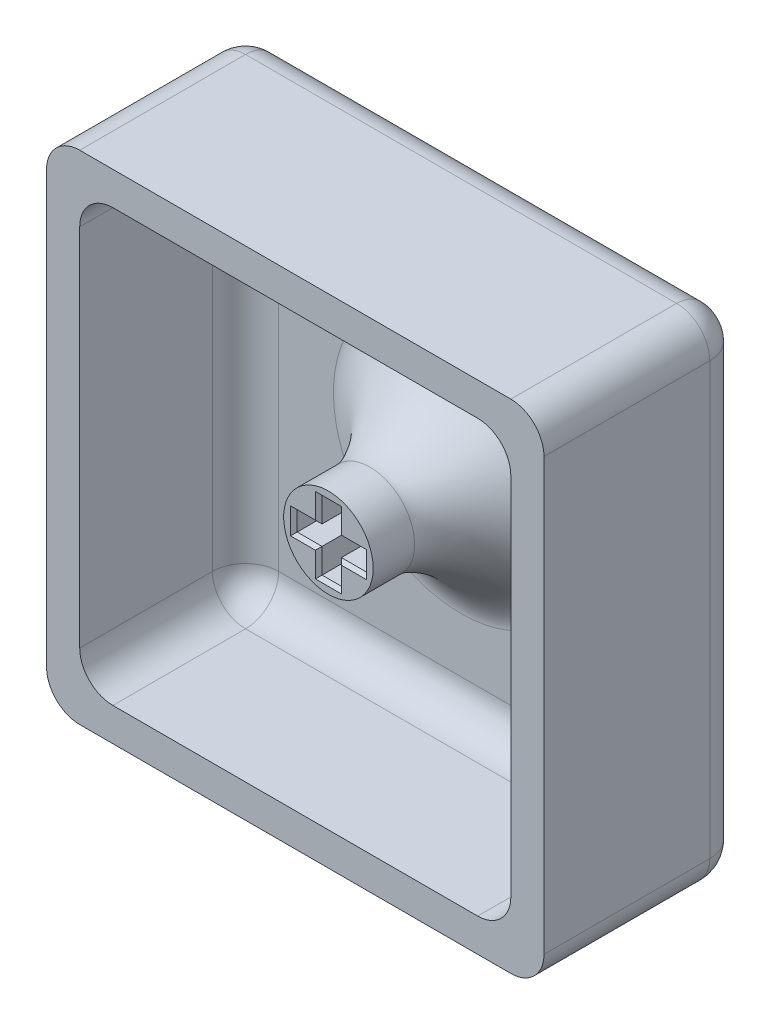
from build123d import *

# Parameters (mm, degrees)
EXTRUDE_1_DEPTH = 10
SKETCH_1_6_R    = 2.7
EXTRUDE_2_DEPTH = 8
EXTRUDE_START   = -2
EXTRUDE_3_DEPTH = 2
FILLET_1_R      = 2
CHAMFER_1_SIZE  = 0.2
FILLET_2_R      = 2
FILLET_3_SIZE   = 5
FILLET_3_SIZE_2 = 5.5


with BuildPart() as part:
    # 草图1 → 凸台-拉伸1 (new body)
    with BuildSketch(Plane.XY):
        with BuildLine():
            ThreePointArc((-15, 13), (-14.414213562, 14.414213562), (-13, 15))
            Line((-13, 15), (13, 15))
            ThreePointArc((13, 15), (14.414213562, 14.414213562), (15, 13))
            Line((15, 13), (15, -13))
            ThreePointArc((15, -13), (14.414213562, -14.414213562), (13, -15))
            Line((13, -15), (-13, -15))
            ThreePointArc((-13, -15), (-14.414213562, -14.414213562), (-15, -13))
            Line((-15, -13), (-15, 13))
        make_face()
        with BuildLine():
            ThreePointArc((-13, -11), (-12.414213562, -12.414213562), (-11, -13))
            Line((-11, -13), (11, -13))
            ThreePointArc((11, -13), (12.414213562, -12.414213562), (13, -11))
            Line((13, -11), (13, 11))
            ThreePointArc((13, 11), (12.414213562, 12.414213562), (11, 13))
            Line((11, 13), (-11, 13))
            ThreePointArc((-11, 13), (-12.414213562, 12.414213562), (-13, 11))
            Line((-13, 11), (-13, -11))
        make_face(mode=Mode.SUBTRACT)
    extrude(amount=EXTRUDE_1_DEPTH)



with BuildPart() as body_2:
    # 草图1<6> → 凸台-拉伸2 (new body)
    with BuildSketch(Plane.XY):
        Circle(SKETCH_1_6_R)
        Polygon((-2.085, -0.585), (-2.085, 0.585), (-0.585, 0.585), (-0.585, 2.085), (0.585, 2.085), (0.585, 0.585), (2.085, 0.585), (2.085, -0.585), (0.585, -0.585), (0.585, -2.085), (-0.585, -2.085), (-0.585, -0.585), align=None, mode=Mode.SUBTRACT)
    extrude(amount=EXTRUDE_2_DEPTH)


with BuildPart() as part_1:
    add(part.part)

    add(body_2.part)  # 凸台-拉伸3 merges body 2
    # 草图1<7> → 凸台-拉伸3 (add)
    with BuildSketch(Plane.XY.offset(EXTRUDE_START)):
        with BuildLine():
            Line((-13, 15), (13, 15))
            ThreePointArc((13, 15), (14.414213562, 14.414213562), (15, 13))
            Line((15, 13), (15, -13))
            ThreePointArc((15, -13), (14.414213562, -14.414213562), (13, -15))
            Line((13, -15), (-13, -15))
            ThreePointArc((-13, -15), (-14.414213562, -14.414213562), (-15, -13))
            Line((-15, -13), (-15, 13))
            ThreePointArc((-15, 13), (-14.414213562, 14.414213562), (-13, 15))
        make_face()
    extrude(amount=EXTRUDE_3_DEPTH)

    # 圆角1
    fillet_1_edges = [part_1.edges().sort_by_distance(p)[0] for p in [
        (-14.414213562, -14.414213562, -2),
        (-15, 0, -2),
        (14.414213562, 14.414213562, -2),
        (14.414213562, -14.414213562, -2),
        (0, -15, -2),
        (-14.414213562, 14.414213562, -2),
        (0, 15, -2),
        (15, 0, -2),
    ]]
    fillet(fillet_1_edges, radius=FILLET_1_R)

    # 倒角1
    chamfer_1_edges = [part_1.edges().sort_by_distance(p)[0] for p in [
        (1.335, -0.585, 8),
        (0, -2.085, 8),
        (-0.585, -1.335, 8),
        (-1.335, -0.585, 8),
        (-2.085, 0, 8),
        (-0.585, 1.335, 8),
        (0, 2.085, 8),
        (0.585, 1.335, 8),
        (1.335, 0.585, 8),
        (2.085, 0, 8),
        (0.585, -1.335, 8),
        (-1.335, 0.585, 8),
    ]]
    chamfer(chamfer_1_edges, length=CHAMFER_1_SIZE)

    # 圆角2
    fillet_2_edges = [part_1.edges().sort_by_distance(p)[0] for p in [
        (0, -13, 0),
        (12.414213562, -12.414213562, 0),
        (13, 0, 0),
        (12.414213562, 12.414213562, 0),
        (0, 13, 0),
        (-12.414213562, 12.414213562, 0),
        (-13, 0, 0),
        (-12.414213562, -12.414213562, 0),
    ]]
    fillet(fillet_2_edges, radius=FILLET_2_R)

    # 圆角3
    # a fillet whose section is not a circle: 5.5, 5 mm, written as the material it adds along each edge
    with BuildSketch(Plane(origin=(0, 0, 0), x_dir=(1, 0, 0), z_dir=(0, -1, 0))) as fillet_3_piece_1:
        with BuildLine():
            Bezier((2.7 + FILLET_3_SIZE, 0), (2.7, 0), (2.7, FILLET_3_SIZE_2), weights=[1, 0.333333333, 1])
            Line((2.7, FILLET_3_SIZE_2), (2.7, 0))
            Line((2.7, 0), (2.7 + FILLET_3_SIZE, 0))
        make_face()
    revolve(axis=Axis((0, 0, 0), (0, 0, 1)))


solid = part_1.part
